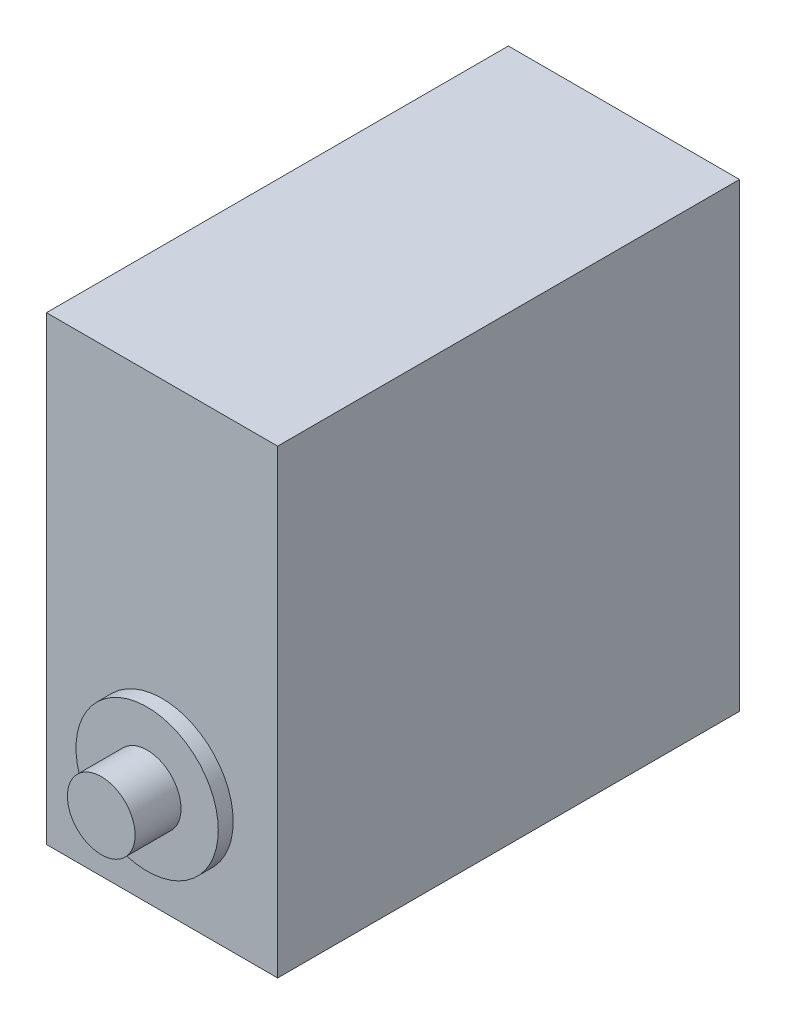
from build123d import *

# Parameters (mm, degrees)
SKETCH1_W           = 40.15
SKETCH1_H           = 20.15
BOSS_EXTRUDE1_DEPTH = 20.13
SKETCH2_R           = 6.2
BOSS_EXTRUDE2_DEPTH = 1.3
SKETCH3_R           = 3
BOSS_EXTRUDE3_DEPTH = 4
SKETCH7_R           = 2.95
BOSS_EXTRUDE4_DEPTH = 4


with BuildPart() as part:
    # Sketch1 → Boss-Extrude1 (new, symmetric)
    with BuildSketch(Plane(origin=(0, 0, 0), x_dir=(0, 1, 0), z_dir=(0, 0, 1))):
        Rectangle(SKETCH1_W, SKETCH1_H)
    extrude(amount=BOSS_EXTRUDE1_DEPTH, both=True)

    # Sketch2 → Boss-Extrude2 (add)
    with BuildSketch(Plane.XY.offset(20.13)):
        with Locations((0, -10.205)):
            Circle(SKETCH2_R)
    boss_extrude2 = extrude(amount=BOSS_EXTRUDE2_DEPTH)

    # Mirror1: Boss-Extrude2 across plane
    add(boss_extrude2.mirror(Plane.XY))

    # Sketch3 → Boss-Extrude3 (add)
    with BuildSketch(Plane(origin=(0, 0, -21.43), x_dir=(1, 0, 0), z_dir=(0, 0, -1))):
        with Locations((0, 10.205)):
            Circle(SKETCH3_R)
    extrude(amount=BOSS_EXTRUDE3_DEPTH)

    # Sketch7 → Boss-Extrude4 (add)
    with BuildSketch(Plane.XY.offset(21.43)):
        with Locations((0, -10.205)):
            Circle(SKETCH7_R)
    extrude(amount=BOSS_EXTRUDE4_DEPTH)


solid = part.part
